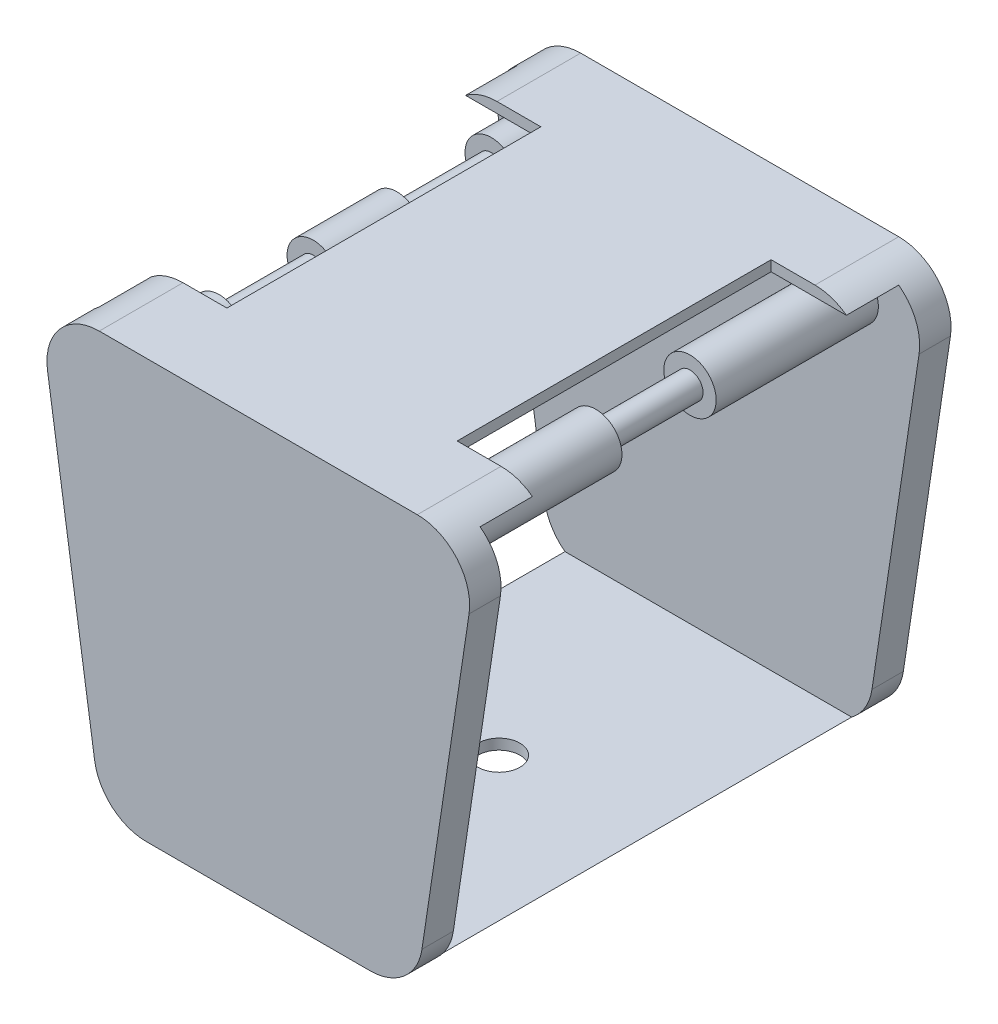
from build123d import *

# Parameters (mm, degrees)
BOSS_EXTRUDE1_DEPTH = 46
SKETCH4_W           = 80
SKETCH4_H           = 76
CUT_EXTRUDE1_DEPTH  = 46
SKETCH5_R           = 5
BOSS_EXTRUDE2_DEPTH = 8
SKETCH6_R           = 2.5
BOSS_EXTRUDE3_DEPTH = 18
SKETCH8_R           = 2.5
BOSS_EXTRUDE4_DEPTH = 18
SKETCH9_R           = 5
BOSS_EXTRUDE5_DEPTH = 14
BOSS_EXTRUDE6_START = 14
SKETCH10_R          = 5
BOSS_EXTRUDE6_DEPTH = 14
SKETCH11_R          = 2.5
BOSS_EXTRUDE7_DEPTH = 9
SKETCH12_R          = 5
BOSS_EXTRUDE8_DEPTH = 31
BOSS_EXTRUDE9_START = 31
SKETCH13_R          = 5
BOSS_EXTRUDE9_DEPTH = 31
SKETCH14_W          = 20
SKETCH14_H          = 60
CUT_EXTRUDE2_DEPTH  = 2.2
FILLET1_R           = 10
FILLET2_R           = 10
SKETCH15_R          = 4
CUT_EXTRUDE3_DEPTH  = 2.2


with BuildPart() as part:
    # Sketch3 → Boss-Extrude1 (new, symmetric)
    with BuildSketch(Plane.XY):
        Polygon((42, 40), (-42, 40), (-30, -40), (30, -40), align=None)
    extrude(amount=BOSS_EXTRUDE1_DEPTH, both=True)

    # Sketch4 → Cut-Extrude1 (cut, symmetric)
    with BuildSketch(Plane(origin=(0, 0, 0), x_dir=(0, 0, -1), z_dir=(1, 0, 0))):
        Rectangle(SKETCH4_W, SKETCH4_H)
    extrude(amount=CUT_EXTRUDE1_DEPTH, both=True, mode=Mode.SUBTRACT)



with BuildPart() as body_2:
    # Sketch5 → Boss-Extrude2 (new, symmetric)
    with BuildSketch(Plane.XY):
        with Locations((-27.5, 32.5)):
            Circle(SKETCH5_R)
    extrude(amount=BOSS_EXTRUDE2_DEPTH, both=True)

    # Sketch6 → Boss-Extrude3 (add)
    with BuildSketch(Plane.XY.offset(8)):
        with Locations((-27.5, 32.5)):
            Circle(SKETCH6_R)
    extrude(amount=BOSS_EXTRUDE3_DEPTH)

    # Sketch8 → Boss-Extrude4 (add)
    with BuildSketch(Plane(origin=(0, 0, -8), x_dir=(-1, 0, 0), z_dir=(0, 0, -1))):
        with Locations(Location((27.5, 32.5, 0), (0, 0, 180))):
            Circle(SKETCH8_R)
    extrude(amount=BOSS_EXTRUDE4_DEPTH)


with BuildPart() as part_1:
    add(part.part)

    add(body_2.part)  # Boss-Extrude5 merges body 2
    # Sketch9 → Boss-Extrude5 (add)
    with BuildSketch(Plane(origin=(0, 0, -26), x_dir=(-1, 0, 0), z_dir=(0, 0, -1))):
        with Locations(Location((27.5, 32.5, 0), (0, 0, 180))):
            Circle(SKETCH9_R)
    extrude(amount=BOSS_EXTRUDE5_DEPTH)

    # Sketch10 → Boss-Extrude6 (add)
    with BuildSketch(Plane.XY.offset(26).offset(BOSS_EXTRUDE6_START)):
        with Locations((-27.5, 32.5)):
            Circle(SKETCH10_R)
    extrude(amount=-BOSS_EXTRUDE6_DEPTH)



with BuildPart() as body_2_2:
    # Sketch11 → Boss-Extrude7 (new, symmetric)
    with BuildSketch(Plane.XY):
        with Locations((27.5, 32.5)):
            Circle(SKETCH11_R)
    extrude(amount=BOSS_EXTRUDE7_DEPTH, both=True)


with BuildPart() as part_2:
    add(part_1.part)

    add(body_2_2.part)  # Boss-Extrude8 merges body 2 2
    # Sketch12 → Boss-Extrude8 (add)
    with BuildSketch(Plane.XY.offset(9)):
        with Locations(Location((27.5, 32.5, 0), (0, 0, 180))):
            Circle(SKETCH12_R)
    extrude(amount=BOSS_EXTRUDE8_DEPTH)

    # Sketch13 → Boss-Extrude9 (add)
    with BuildSketch(Plane(origin=(0, 0, -9), x_dir=(-1, 0, 0), z_dir=(0, 0, -1)).offset(BOSS_EXTRUDE9_START)):
        with Locations((-27.5, 32.5)):
            Circle(SKETCH13_R)
    extrude(amount=-BOSS_EXTRUDE9_DEPTH)

    # Sketch14 → Cut-Extrude2 (cut)
    with BuildSketch(Plane(origin=(0, 40, 0), x_dir=(1, 0, 0), z_dir=(0, 1, 0))):
        with Locations((32, 0)):
            Rectangle(SKETCH14_W, SKETCH14_H)
        with Locations((-32, 0)):
            Rectangle(SKETCH14_W, SKETCH14_H)
    extrude(amount=-CUT_EXTRUDE2_DEPTH, mode=Mode.SUBTRACT)

    # Fillet1
    fillet1_edges = [part_2.edges().sort_by_distance(p)[0] for p in [
        (42, 40, 38),
        (-42, 40, 38),
        (-42, 40, -38),
        (42, 40, -38),
    ]]
    fillet(fillet1_edges, radius=FILLET1_R)

    # Fillet2
    # the kernel refuses this fillet: 10 mm, written as the material it takes off along each edge
    with BuildSketch(Plane(origin=(-30, -40, -67.52968552), x_dir=(-0.1483404529302443, 0.9889363528682976, 0), z_dir=(0, 0, 1)), Plane(origin=(30, -40, 67.52968552), x_dir=(0.14834045293024473, 0.9889363528682976, 0), z_dir=(0, 0, -1))) as fillet2_piece_1:
        with BuildLine():
            CenterArc((FILLET2_R * 0.861187420808, -FILLET2_R), FILLET2_R, 90, 81.46923439)
            Line((-FILLET2_R * 0.12774893206, -FILLET2_R * 0.85165954707), (0, 0))
            Line((0, 0), (FILLET2_R * 0.861187420808, 0))
        make_face()
    extrude(amount=135.05937104, mode=Mode.SUBTRACT)

    # Sketch15 → Cut-Extrude3 (cut)
    with BuildSketch(Plane.XZ.offset(40)):
        Circle(SKETCH15_R)
    extrude(amount=-CUT_EXTRUDE3_DEPTH, mode=Mode.SUBTRACT)


solid = part_2.part
